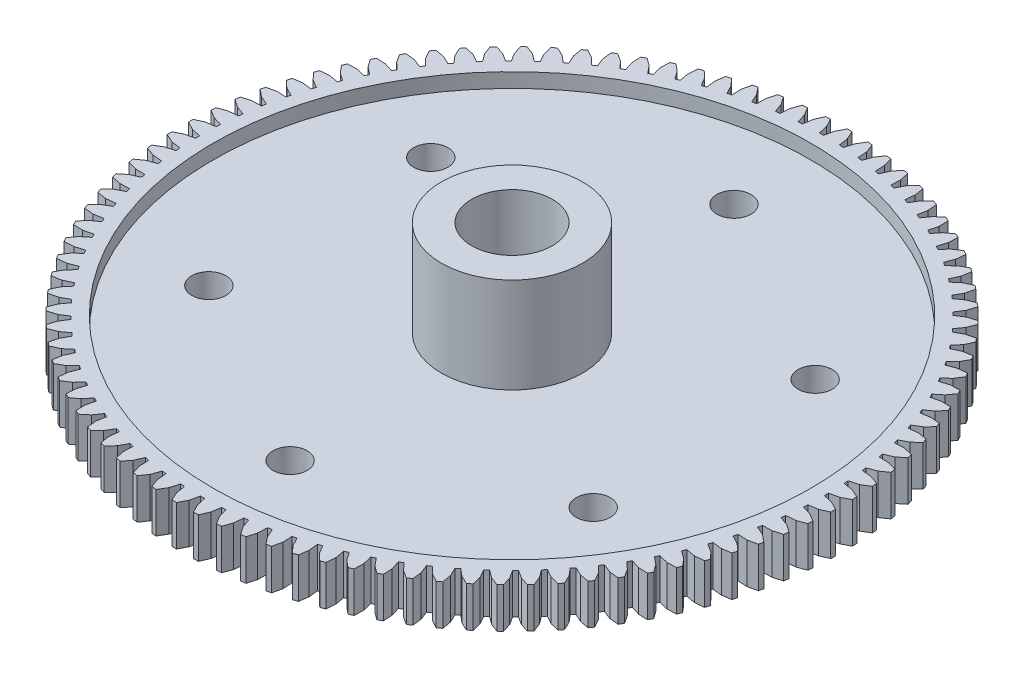
from build123d import *

# Parameters (mm, degrees)
SKETCH1_R           = 25.9334
BOSS_EXTRUDE1_DEPTH = 3.175
SKETCH2_R           = 5.5499
BOSS_EXTRUDE2_DEPTH = 6.35
SKETCH3_R           = 3.175
CUT_EXTRUDE1_DEPTH  = 38.892058484
CUT_EXTRUDE2_START  = -1.143
SKETCH4_R           = 23.5204
SKETCH4_R_2         = 5.5499
CUT_EXTRUDE2_DEPTH  = 1.143
SKETCH5_R           = 1.3462
CUT_EXTRUDE3_DEPTH  = 38.221028614
CIRPATTERN1_COUNT   = 6
CUT_EXTRUDE4_DEPTH  = 38.221028614
CIRPATTERN2_COUNT   = 96


with BuildPart() as part:
    # Sketch1 → Boss-Extrude1 (new body)
    with BuildSketch(Plane(origin=(0, 0, 0), x_dir=(1, 0, 0), z_dir=(0, 1, 0))):
        with Locations(Location((0, 0, 0), (0, 0, 270))):
            Circle(SKETCH1_R)
    extrude(amount=BOSS_EXTRUDE1_DEPTH)

    # Sketch2 → Boss-Extrude2 (add)
    with BuildSketch(Plane(origin=(0, 3.175, 0), x_dir=(1, 0, 0), z_dir=(0, 1, 0))):
        with Locations(Location((0, 0, 0), (0, 0, 270))):
            Circle(SKETCH2_R)
    extrude(amount=BOSS_EXTRUDE2_DEPTH)

    # Sketch3 → Cut-Extrude1 (cut, through all)
    with BuildSketch(Plane(origin=(0, 9.525, 0), x_dir=(1, 0, 0), z_dir=(0, 1, 0))):
        with Locations(Location((0, 0, 0), (0, 0, 270))):
            Circle(SKETCH3_R)
    extrude(amount=-CUT_EXTRUDE1_DEPTH, mode=Mode.SUBTRACT)

    # Sketch4 → Cut-Extrude2 (cut)
    with BuildSketch(Plane(origin=(0, 3.175, 0), x_dir=(1, 0, 0), z_dir=(0, 1, 0)).offset(CUT_EXTRUDE2_START)):
        with Locations(Location((0, 0, 0), (0, 0, 270))):
            Circle(SKETCH4_R)
        with Locations(Location((0, 0, 0), (0, 0, 270))):
            Circle(SKETCH4_R_2, mode=Mode.SUBTRACT)
    extrude(amount=CUT_EXTRUDE2_DEPTH, mode=Mode.SUBTRACT)

    # Sketch5 → Cut-Extrude3 (cut, through all)
    with BuildSketch(Plane(origin=(0, 3.175, 0), x_dir=(1, 0, 0), z_dir=(0, 1, 0))):
        with Locations(Location((0, 17.4625, 0), (0, 0, 270))):
            Circle(SKETCH5_R)
    cut_extrude3 = extrude(amount=-CUT_EXTRUDE3_DEPTH, mode=Mode.SUBTRACT)

    # CirPattern1: Cut-Extrude3 ×6 about axis
    cirpattern1_axis = Axis((0, 0, 0), (0, 1, 0))
    for i in range(1, CIRPATTERN1_COUNT):
        add(cut_extrude3.rotate(cirpattern1_axis, i * 360 / CIRPATTERN1_COUNT), mode=Mode.SUBTRACT)

    # Sketch6 → Cut-Extrude4 (cut, through all)
    with BuildSketch(Plane(origin=(0, 3.175, 0), x_dir=(1, 0, 0), z_dir=(0, 1, 0))):
        Polygon((-59.39647831, 138.372032762), (-0.864630885, 25.9334), (-0.521377679, 25.274016728), (-0.360481492, 24.548260928), (-0.033415885, 24.548260928), (0.127480302, 25.274016728), (0.470733508, 25.9334), (59.002580932, 138.372032762), (59.002580932, 391.894602173), (-59.39647831, 391.894602173), align=None)
    cut_extrude4 = extrude(amount=-CUT_EXTRUDE4_DEPTH, mode=Mode.SUBTRACT)

    # CirPattern2: Cut-Extrude4 ×96 about axis
    cirpattern2_axis = Axis((0, 3.175, 0), (0, -1, 0))
    for i in range(1, CIRPATTERN2_COUNT):
        add(cut_extrude4.rotate(cirpattern2_axis, i * 360 / CIRPATTERN2_COUNT), mode=Mode.SUBTRACT)


solid = part.part
